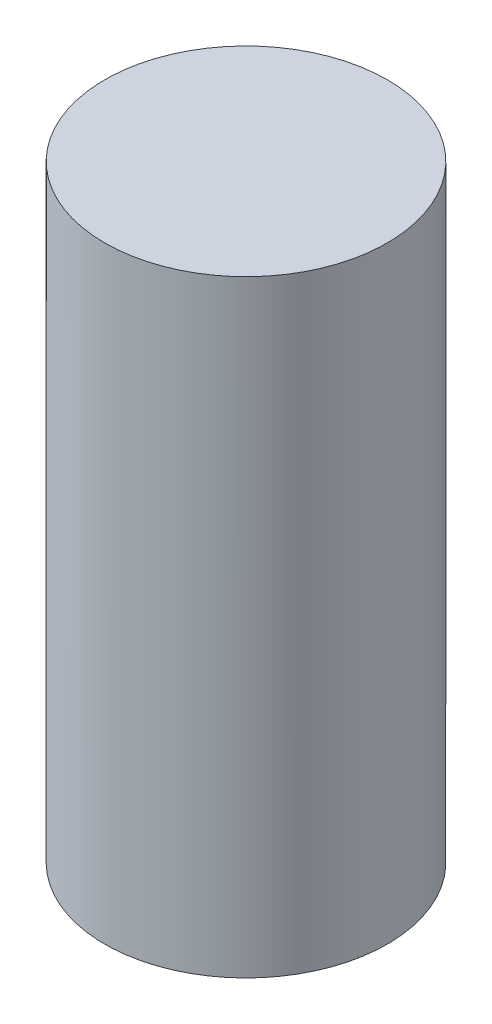
from build123d import *

# Parameters (mm, degrees)
ESQUISSE1_R        = 73.61
BOSS_EXTRU_1_DEPTH = 320
SKETCH2_W          = 28.172885559
SKETCH2_H          = 11.937663373


with BuildPart() as part:
    # Esquisse1 → Boss.-Extru.1 (new body)
    with BuildSketch(Plane(origin=(0, 0, 0), x_dir=(1, 0, 0), z_dir=(0, 1, 0))):
        Circle(ESQUISSE1_R)
    extrude(amount=BOSS_EXTRU_1_DEPTH)

    # Sketch2 → Cut-Revolve1 (revolve, cut)
    with BuildSketch(Plane.XY):
        with Locations((75.207279249, -2.35222187)):
            Rectangle(SKETCH2_W, SKETCH2_H)
    revolve(axis=Axis((0, 187.934132292, 0), (0, -1, 0)), mode=Mode.SUBTRACT)


solid = part.part
